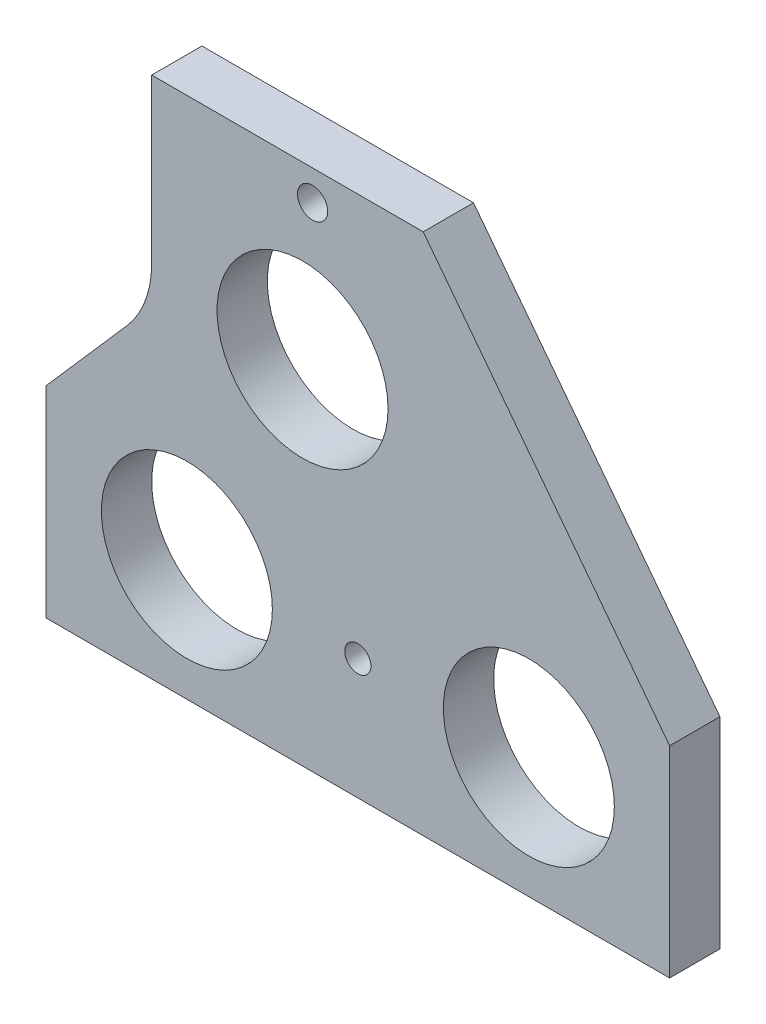
from build123d import *

# Parameters (mm, degrees)
SZKIC1_R                    = 8.5
SZKIC1_R_2                  = 1.5
SZKIC1_R_3                  = 1.3
DODANIE_WYCI_GNI_CIE1_DEPTH = 5
ZAOKR_GLENIE1_R             = 10


with BuildPart() as part:
    # Szkic1 → Dodanie-wyciągnięcie1 (new body)
    with BuildSketch(Plane.XY):
        Polygon((-14, -12), (-14, 8), (-3.5, 20), (-3.5, 40), (23.5, 40), (48, 8), (48, -12), align=None)
        Circle(SZKIC1_R, mode=Mode.SUBTRACT)
        with Locations((34, 0)):
            Circle(SZKIC1_R, mode=Mode.SUBTRACT)
        with Locations((11.5, 23)):
            Circle(SZKIC1_R, mode=Mode.SUBTRACT)
        with Locations((12.5, 37)):
            Circle(SZKIC1_R_2, mode=Mode.SUBTRACT)
        with Locations((17, 0)):
            Circle(SZKIC1_R_3, mode=Mode.SUBTRACT)
    extrude(amount=DODANIE_WYCI_GNI_CIE1_DEPTH)

    # Zaokrąglenie1
    zaokr_glenie1_edges = [part.edges().sort_by_distance(p)[0] for p in [
        (-3.5, 20, 2.5),
    ]]
    fillet(zaokr_glenie1_edges, radius=ZAOKR_GLENIE1_R)


solid = part.part
